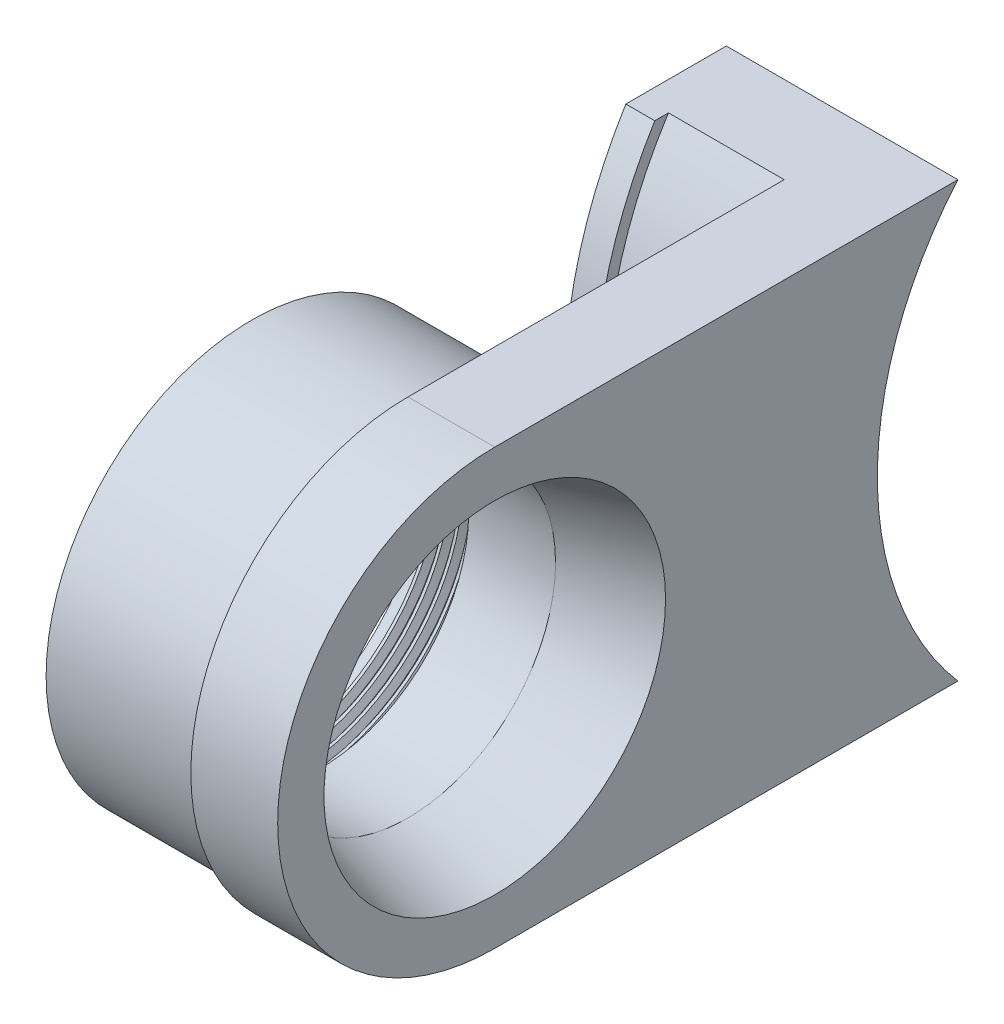
from build123d import *

# Parameters (mm, degrees)
SKETCH1_R           = 25.5
BOSS_EXTRUDE1_DEPTH = 15
BOSS_EXTRUDE2_START = 20
BOSS_EXTRUDE2_DEPTH = 20
BOSS_EXTRUDE4_START = 5
BOSS_EXTRUDE4_DEPTH = 5
SKETCH14_R          = 35.5
SKETCH14_R_2        = 25.5
BOSS_EXTRUDE5_DEPTH = 27
CUT_EXTRUDE3_START  = -12
SKETCH15_R          = 30.5
SKETCH15_R_2        = 25.5
CUT_EXTRUDE3_DEPTH  = 12
THREAD1_PITCH       = 2


with BuildPart() as part:
    # Sketch1 → Boss-Extrude1 (new body)
    with BuildSketch(Plane(origin=(0, 0, 0), x_dir=(0, 0, -1), z_dir=(1, 0, 0))):
        with BuildLine():
            Line((0, 37.5), (-80, 37.5))
            ThreePointArc((-80, 37.5), (-117.5, 0), (-80, -37.5))
            Line((-80, -37.5), (0, -37.5))
            ThreePointArc((0, -37.5), (-13.911010565, 0), (0, 37.5))
        make_face()
        with Locations((-80, 0)):
            Circle(SKETCH1_R, mode=Mode.SUBTRACT)
    extrude(amount=BOSS_EXTRUDE1_DEPTH)

    # Sketch2 → Boss-Extrude2 (add)
    with BuildSketch(Plane.ZY.offset(BOSS_EXTRUDE2_START)):
        with BuildLine():
            Line((0, 37.5), (15, 37.5))
            ThreePointArc((15, 37.5), (25.973354423, 0), (15, -37.5))
            Line((15, -37.5), (0, -37.5))
            ThreePointArc((0, -37.5), (13.911010565, 0), (0, 37.5))
        make_face()
    extrude(amount=-BOSS_EXTRUDE2_DEPTH)

    # Sketch4 → Boss-Extrude4 (add)
    with BuildSketch(Plane.ZY.offset(20).offset(BOSS_EXTRUDE4_START)):
        with BuildLine():
            Line((0, 37.5), (17.361146401, 37.5))
            ThreePointArc((17.361146401, 37.5), (27.973354423, 0), (17.361146401, -37.5))
            Line((17.361146401, -37.5), (0, -37.5))
            ThreePointArc((0, -37.5), (13.911010565, 0), (0, 37.5))
        make_face()
    extrude(amount=-BOSS_EXTRUDE4_DEPTH)

    # Sketch13 → Cut-Revolve2 (revolve, cut)
    with BuildSketch(Plane(origin=(0, 0, 0), x_dir=(1, 0, 0), z_dir=(0, 1, 0)), mode=Mode.PRIVATE) as cut_revolve2_sk:
        Polygon((15, -109.5), (0, -105.5), (15, -105.5), align=None)
    revolve(cut_revolve2_sk.sketch.rotate(Axis((15, 0, 80), (-1, 0, 0)), 180), axis=Axis((15, 0, 80), (-1, 0, 0)), mode=Mode.SUBTRACT)

    # Sketch14 → Boss-Extrude5 (add)
    with BuildSketch(Plane.ZY):
        with Locations(Location((80, 0, 0), (0, 0, 180))):
            Circle(SKETCH14_R)
        with Locations(Location((80, 0, 0), (0, 0, 180))):
            Circle(SKETCH14_R_2, mode=Mode.SUBTRACT)
    extrude(amount=BOSS_EXTRUDE5_DEPTH)

    # Sketch15 → Cut-Extrude3 (cut)
    with BuildSketch(Plane.ZY.offset(27).offset(CUT_EXTRUDE3_START)):
        with Locations((80, 0)):
            Circle(SKETCH15_R)
        with Locations(Location((80, 0, 0), (0, 0, 180))):
            Circle(SKETCH15_R_2, mode=Mode.SUBTRACT)
    extrude(amount=CUT_EXTRUDE3_DEPTH, mode=Mode.SUBTRACT)

    # Thread1: the profile of Thread Profile1 profile screwed along a right-hand helix of 6 turns, 10 arcs to a turn; built about Z, then put on its axis
    thread1_z = Axis((0, 0, 0), (0, 0, 1))
    thread1_corners = [(30.5003, 0, -0.000173205), (30.5003, 0, 1.7501732), (29.41746825, 0, 1.124999997), (29.41746825, 0, 0.624999997)]
    with BuildLine(mode=Mode.PRIVATE) as thread1_profile:
        Line(thread1_corners[0], thread1_corners[1])
        Line(thread1_corners[1], thread1_corners[2])
        Line(thread1_corners[2], thread1_corners[3])
        Line(thread1_corners[3], thread1_corners[0])
    thread1_cap = Face(thread1_profile.wire())
    thread1_turn_angles = [0, 18, 36, 54, 72, 90, 108, 126, 144, 162, 180, 198, 216, 234, 252, 270, 288, 306, 324, 342, 360]
    thread1_turn_weights = [1, 0.9510565162951535, 1, 0.9510565162951535, 1, 0.9510565162951535, 1, 0.9510565162951535, 1, 0.9510565162951535, 1, 0.9510565162951535, 1, 0.9510565162951535, 1, 0.9510565162951535, 1, 0.9510565162951535, 1, 0.9510565162951535, 1]
    thread1_turn_rails = [Edge.make_bspline([Vector(p[0], p[1], 0).rotate(thread1_z, thread1_turn_angles[k]) / thread1_turn_weights[k] + Vector(0, 0, p[2] + THREAD1_PITCH * thread1_turn_angles[k] / 360) for k in range(21)], [0, 0, 0, 1, 1, 2, 2, 3, 3, 4, 4, 5, 5, 6, 6, 7, 7, 8, 8, 9, 9, 10, 10, 10], 2, thread1_turn_weights) for p in thread1_corners]
    thread1_turn_sides = [Face.make_surface_from_curves(thread1_turn_rails[p[0]], thread1_turn_rails[p[1]]) for p in [(0, 1), (1, 2), (2, 3), (3, 0)]]
    thread1 = Plane(origin=(-27, 0, 80), x_dir=(0, 0, -1), z_dir=(1, 0, 0)) * Solid(Shell([*[p.moved(Location((0, 0, THREAD1_PITCH * i))) for i in range(6) for p in thread1_turn_sides], thread1_cap, thread1_cap.rotate(thread1_z, 2160).moved(Location((0, 0, THREAD1_PITCH * 2160 / 360)))]))
    add(thread1)


solid = part.part
